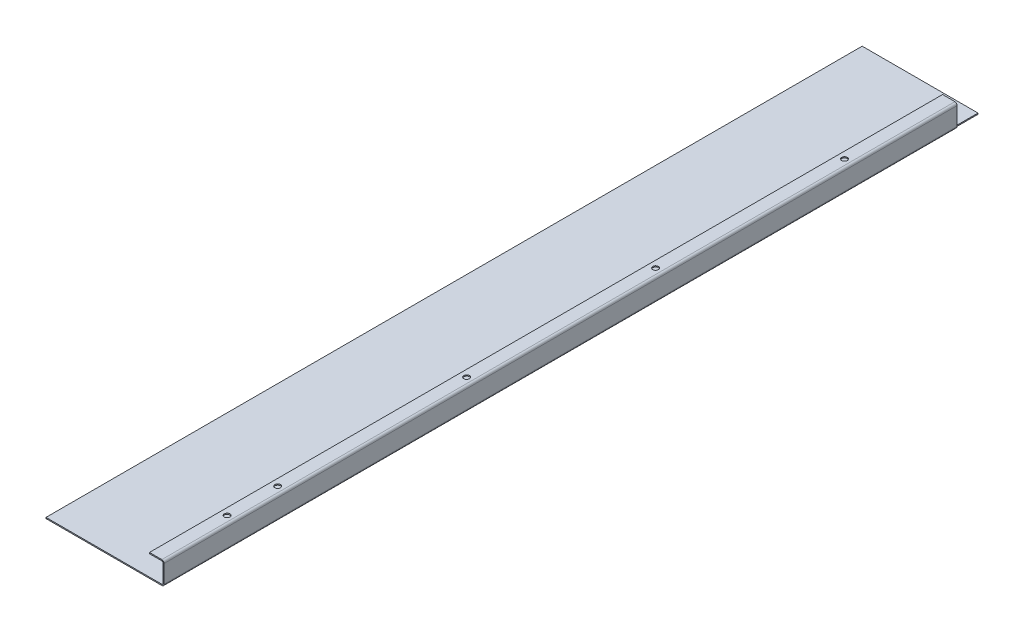
from build123d import *

# Parameters (mm, degrees)
SKETCH1_W                    = 105
SKETCH1_H                    = 725.7
BASE_FLANGE1_DEPTH           = 1
EDGE_FLANGE1_STRIP_W         = 6
EDGE_FLANGE1_STRIP_H         = 1
EDGE_FLANGE1_STRIP_CUT_DEPTH = 725.7
EDGE_FLANGE1_DEPTH           = 725.7
EDGE_FLANGE2_STRIP_W         = 6
EDGE_FLANGE2_STRIP_H         = 1
EDGE_FLANGE2_STRIP_CUT_DEPTH = 725.7
EDGE_FLANGE2_DEPTH           = 725.7
SKETCH19_R                   = 2.5
CUT_EXTRUDE2_DEPTH           = 10
CUT_EXTRUDE3_START           = -725.7
CUT_EXTRUDE3_DEPTH           = 20.5


# Read off the part's stored shape, not the designer's step: Cut-Extrude3
# Sheet-metal steps are written as plain solids
with BuildPart() as part:
    # Sketch1 → Base-Flange1 (new body)
    with BuildSketch(Plane(origin=(0, 0, 0), x_dir=(1, 0, 0), z_dir=(0, 1, 0))):
        with Locations((52.5, 362.85)):
            Rectangle(SKETCH1_W, SKETCH1_H)
    extrude(amount=-BASE_FLANGE1_DEPTH)

    # Edge-Flange1 strip (across the edge) → Edge-Flange1 strip cut (cut)
    with BuildSketch(Plane(origin=(105, 0, 0), x_dir=(-1, 0, 0), z_dir=(0, 0, -1))):
        with Locations((-1, -0.5)):
            Rectangle(EDGE_FLANGE1_STRIP_W, EDGE_FLANGE1_STRIP_H)
    extrude(amount=EDGE_FLANGE1_STRIP_CUT_DEPTH, mode=Mode.SUBTRACT)

    # Edge-Flange1 section (across the edge) → Edge-Flange1 (add)
    with BuildSketch(Plane(origin=(105, 0, 0), x_dir=(-1, 0, 0), z_dir=(0, 0, -1))):
        with BuildLine():
            Line((0, 1), (0, 19))
            Line((0, 19), (1, 19))
            Line((1, 19), (1, 1))
            ThreePointArc((1, 1), (1.292893219, 0.292893219), (2, 0))
            Line((2, 0), (2, -1))
            ThreePointArc((2, -1), (0.585786438, -0.414213562), (0, 1))
        make_face()
    extrude(amount=EDGE_FLANGE1_DEPTH)

    # Edge-Flange2 strip (across the edge) → Edge-Flange2 strip cut (cut)
    with BuildSketch(Plane(origin=(104, 19, 0), x_dir=(0, -1, 0), z_dir=(0, 0, -1))):
        with Locations((-1, -0.5)):
            Rectangle(EDGE_FLANGE2_STRIP_W, EDGE_FLANGE2_STRIP_H)
    extrude(amount=EDGE_FLANGE2_STRIP_CUT_DEPTH, mode=Mode.SUBTRACT)

    # Edge-Flange2 section (across the edge) → Edge-Flange2 (add)
    with BuildSketch(Plane(origin=(104, 19, 0), x_dir=(0, -1, 0), z_dir=(0, 0, -1))):
        with BuildLine():
            Line((0, 1), (0, 12))
            Line((0, 12), (1, 12))
            Line((1, 12), (1, 1))
            ThreePointArc((1, 1), (1.292893219, 0.292893219), (2, 0))
            Line((2, 0), (2, -1))
            ThreePointArc((2, -1), (0.585786438, -0.414213562), (0, 1))
        make_face()
    extrude(amount=EDGE_FLANGE2_DEPTH)

    # Sketch19 → Cut-Extrude2 (cut)
    with BuildSketch(Plane(origin=(0, 19, 0), x_dir=(1, 0, 0), z_dir=(0, 1, 0))):
        with Locations(Location((98, 63, 0), (0, 0, 180))):
            Circle(SKETCH19_R)
        with Locations(Location((98, 108, 0), (0, 0, 180))):
            Circle(SKETCH19_R)
        with Locations(Location((98, 276, 0), (0, 0, 180))):
            Circle(SKETCH19_R)
        with Locations(Location((98, 444, 0), (0, 0, 180))):
            Circle(SKETCH19_R)
        with Locations(Location((98, 612, 0), (0, 0, 180))):
            Circle(SKETCH19_R)
        with Locations((98, 780)):
            Circle(SKETCH19_R)
    extrude(amount=-CUT_EXTRUDE2_DEPTH, mode=Mode.SUBTRACT)

    # Cut-Extrude3 outline → Cut-Extrude3 (cut)
    with BuildSketch(Plane.XY.offset(CUT_EXTRUDE3_START)):
        with BuildLine():
            ThreePointArc((104, 1), (103.707106781, 0.292893219), (103, 0))
            Line((103, 0), (103, -1))
            ThreePointArc((103, -1), (104.414213562, -0.414213562), (105, 1))
            Line((105, 1), (105, 17))
            ThreePointArc((105, 17), (104.414213562, 18.414213562), (103, 19))
            Line((103, 19), (92, 19))
            Line((92, 19), (92, 18))
            Line((92, 18), (103, 18))
            ThreePointArc((103, 18), (103.707106781, 17.707106781), (104, 17))
            Line((104, 17), (104, 1))
        make_face()
    extrude(amount=CUT_EXTRUDE3_DEPTH, mode=Mode.SUBTRACT)


solid = part.part
